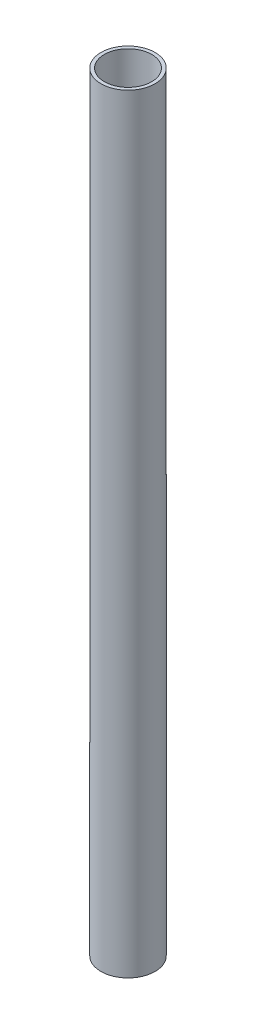
from build123d import *

# Parameters (mm, degrees)
SKETCH1_R           = 8
SKETCH1_R_2         = 7
BOSS_EXTRUDE1_DEPTH = 243.065
CUT_EXTRUDE1_START  = -18.23
SKETCH3_R           = 8
CUT_EXTRUDE1_DEPTH  = 18.23
BOSS_EXTRUDE2_START = 2.36
SKETCH4_R           = 8
SKETCH4_R_2         = 7
BOSS_EXTRUDE2_DEPTH = 2.36


with BuildPart() as part:
    # Sketch1 → Boss-Extrude1 (new body)
    with BuildSketch(Plane(origin=(0, 0, 0), x_dir=(1, 0, 0), z_dir=(0, 1, 0))):
        Circle(SKETCH1_R)
        Circle(SKETCH1_R_2, mode=Mode.SUBTRACT)
    extrude(amount=BOSS_EXTRUDE1_DEPTH)

    # Sketch3 → Cut-Extrude1 (cut)
    with BuildSketch(Plane(origin=(0, 243.065, 0), x_dir=(1, 0, 0), z_dir=(0, 1, 0)).offset(CUT_EXTRUDE1_START)):
        Circle(SKETCH3_R)
    extrude(amount=CUT_EXTRUDE1_DEPTH, mode=Mode.SUBTRACT)

    # Sketch4 → Boss-Extrude2 (add)
    with BuildSketch(Plane.XZ.offset(BOSS_EXTRUDE2_START)):
        Circle(SKETCH4_R)
        Circle(SKETCH4_R_2, mode=Mode.SUBTRACT)
    extrude(amount=-BOSS_EXTRUDE2_DEPTH)


solid = part.part
